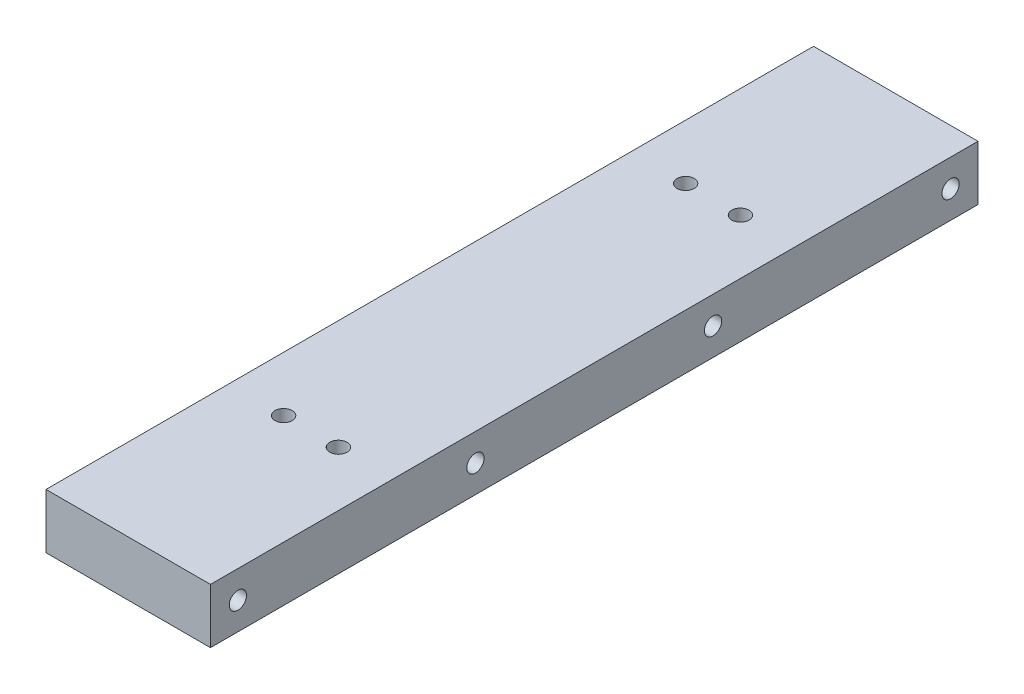
from build123d import *

# Parameters (mm, degrees)
SKETCH2_W             = 28.575
SKETCH2_H             = 133.35
BOSS_EXTRUDE1_DEPTH   = 9.525
F_3_0MM_DOWEL_HOLE1_D = 3
LPATTERN1_COUNT       = 4
LPATTERN1_PITCH       = 41.275
SKETCH8_R             = 1.5
CUT_EXTRUDE2_DEPTH    = 137.709468399


with BuildPart() as part:
    # Sketch2 → Boss-Extrude1 (new body)
    with BuildSketch(Plane(origin=(0, 0, 0), x_dir=(1, 0, 0), z_dir=(0, 1, 0))):
        with Locations((14.2875, 66.675)):
            Rectangle(SKETCH2_W, SKETCH2_H)
    extrude(amount=BOSS_EXTRUDE1_DEPTH)

    # Ø3.0mm Dowel Hole1 (through all)
    with Locations(Plane(origin=(28.575, 0, 0), x_dir=(0, 0, -1), z_dir=(1, 0, 0))):
        with Locations((4.7625, 4.7625)):
            f_3_0mm_dowel_hole1 = Hole(F_3_0MM_DOWEL_HOLE1_D / 2)

    # LPattern1: Ø3.0mm Dowel Hole1 ×4
    with Locations(*[(0, 0, -i * LPATTERN1_PITCH) for i in range(1, LPATTERN1_COUNT)]):
        add(f_3_0mm_dowel_hole1, mode=Mode.SUBTRACT)

    # Sketch8 → Cut-Extrude2 (cut, through all)
    with BuildSketch(Plane.XZ):
        with Locations((9.525, -31.75)):
            Circle(SKETCH8_R)
        with Locations((9.525, -101.6)):
            Circle(SKETCH8_R)
        with Locations((19.05, -101.6)):
            Circle(SKETCH8_R)
        with Locations((19.05, -31.75)):
            Circle(SKETCH8_R)
    extrude(amount=-CUT_EXTRUDE2_DEPTH, mode=Mode.SUBTRACT)


solid = part.part
